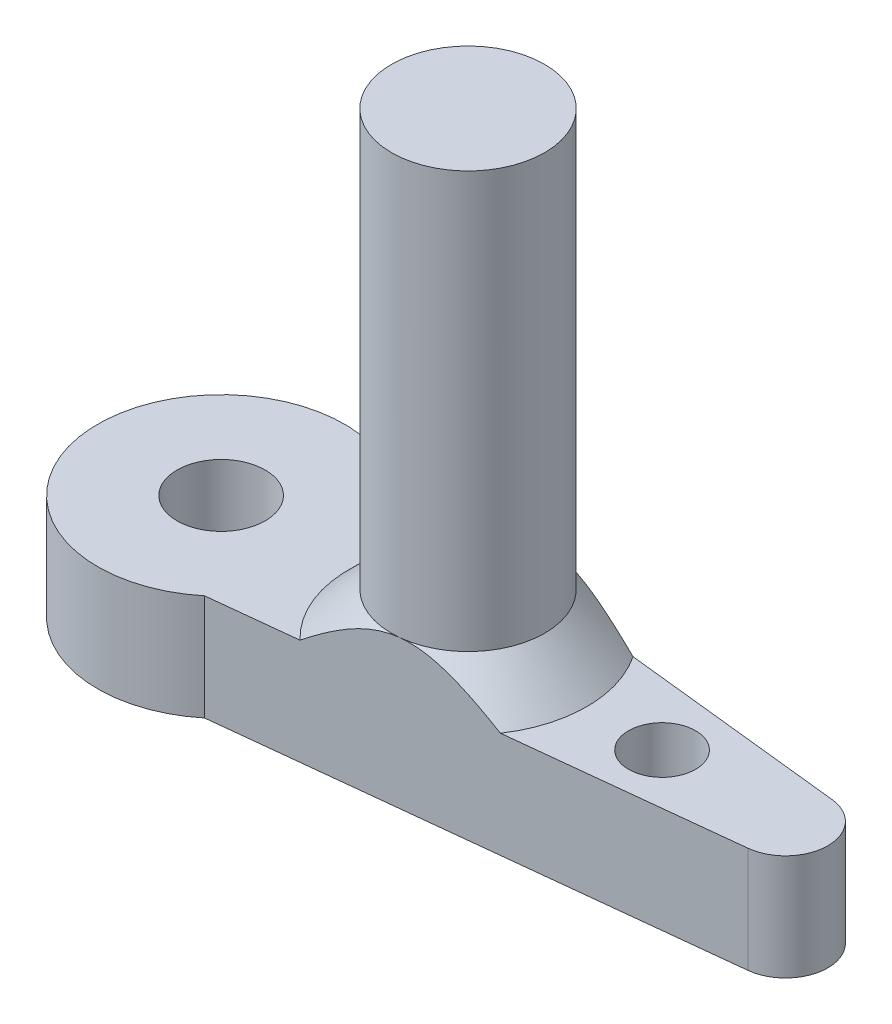
from build123d import *

# Parameters (mm, degrees)
SKETCH1_R           = 0.95
SKETCH1_R_2         = 1.25
BOSS_EXTRUDE1_DEPTH = 3
SKETCH2_R           = 2.169910798
BOSS_EXTRUDE2_DEPTH = 13
CHAMFER1_SIZE       = 1.2


with BuildPart() as part:
    # Sketch1 → Boss-Extrude1 (new body)
    with BuildSketch(Plane(origin=(0, 0, 0), x_dir=(1, 0, 0), z_dir=(0, 1, 0))):
        with BuildLine():
            ThreePointArc((2.227105745, 2.7), (-3.5, 0), (2.227105745, -2.7))
            Line((2.227105745, -2.7), (16.12932144, -1.193011301))
            ThreePointArc((16.12932144, -1.193011301), (17.2, 0), (16.12932144, 1.193011301))
            Line((16.12932144, 1.193011301), (2.227105745, 2.7))
        make_face()
        with Locations(Location((12.5, 0, 0), (0, 0, 270))):
            Circle(SKETCH1_R, mode=Mode.SUBTRACT)
        with Locations(Location((0, 0, 0), (0, 0, 270))):
            Circle(SKETCH1_R_2, mode=Mode.SUBTRACT)
    extrude(amount=BOSS_EXTRUDE1_DEPTH)

    # Sketch2 → Boss-Extrude2 (add)
    with BuildSketch(Plane(origin=(0, 3, 0), x_dir=(1, 0, 0), z_dir=(0, 1, 0))):
        with Locations(Location((7, 0, 0), (0, 0, 83.813341225))):
            Circle(SKETCH2_R)
    extrude(amount=BOSS_EXTRUDE2_DEPTH)

    # Chamfer1
    # the kernel refuses this chamfer: 1.2 mm, written as the material it adds along each edge
    with BuildSketch(Plane(origin=(7, 3, 0), x_dir=(0.1077678664159532, 0, -0.9941760844881318), z_dir=(0.9941760844881318, 0, 0.1077678664159532))) as chamfer1_piece_1_section:
        Polygon((2.169910798 + CHAMFER1_SIZE, 0), (2.169910798, CHAMFER1_SIZE), (2.169910798, 0), align=None)
    chamfer1_piece_1 = revolve(axis=Axis((7, 3, 0), (0, 1, 0)), revolution_arc=192.373317929, mode=Mode.PRIVATE)
    chamfer1_piece_1 = split(chamfer1_piece_1, bisect_by=Plane(origin=(4.507411797, 3.588560711, 2.452816707), z_dir=(-0.10776786640872232, 0, -0.9941760844889158)), keep=Keep.TOP, mode=Mode.PRIVATE)
    chamfer1_piece_1 = split(chamfer1_piece_1, bisect_by=Plane(origin=(4.507411799, 3.588560711, -2.452816707), z_dir=(-0.10776786640872232, 0, 0.9941760844889158)), keep=Keep.TOP, mode=Mode.PRIVATE)
    add(chamfer1_piece_1)
    with BuildSketch(Plane(origin=(7, 3, 0), x_dir=(0.1077678729849121, 0, 0.9941760837760621), z_dir=(-0.9941760837760621, 0, 0.1077678729849121))) as chamfer1_piece_2_section:
        Polygon((2.169910798 + CHAMFER1_SIZE, 0), (2.169910798, CHAMFER1_SIZE), (2.169910798, 0), align=None)
    chamfer1_piece_2 = revolve(axis=Axis((7, 3, 0), (0, 1, 0)), revolution_arc=167.626682071, mode=Mode.PRIVATE)
    chamfer1_piece_2 = split(chamfer1_piece_2, bisect_by=Plane(origin=(9.961043045, 3.589331186, 1.861647585), z_dir=(-0.10776786640872232, 0, -0.9941760844889158)), keep=Keep.TOP, mode=Mode.PRIVATE)
    chamfer1_piece_2 = split(chamfer1_piece_2, bisect_by=Plane(origin=(9.961043043, 3.589331186, -1.861647585), z_dir=(-0.10776786640872232, 0, 0.9941760844889158)), keep=Keep.TOP, mode=Mode.PRIVATE)
    add(chamfer1_piece_2)


solid = part.part
